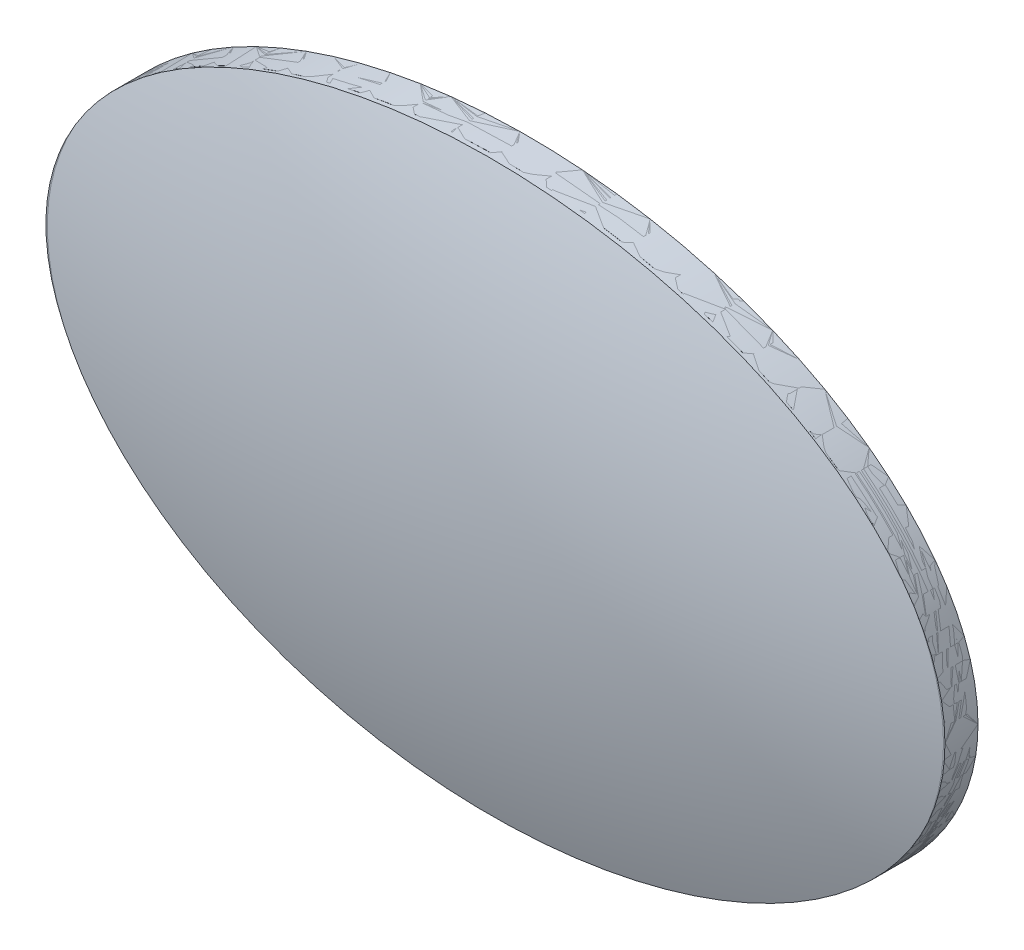
from build123d import *

# Parameters (mm, degrees)
BOSS_EXTRUDE1_DEPTH     = 3.175
SKETCH3_R               = 210.872545424
CUT_EXTRUDE1_DEPTH      = 524.129
CUT_EXTRUDE2_DEPTH      = 524.129
CUT_EXTRUDE2_DEPTH_BACK = 524.129
SKETCH4_R               = 61.79011218
BOSS_EXTRUDE2_REACH     = 53.791
SKETCH6_R               = 4.25
CUT_EXTRUDE3_DEPTH      = 3.5


# Read off the part's stored shape, not the designer's step: Boss-Extrude1
with BuildPart() as part:
    # Boss-Extrude1 outline → Boss-Extrude1 (new body)
    with BuildSketch(Plane.XY):
        with BuildLine():
            add(Edge.make_bspline(
                [(43.18, 0), (43.18, 3.487869372), (41.04308468, 10.463608115), (31.572396318, 19.629385836), (17.132135744, 25.842526194), (0, 28.036236903), (-17.132135744, 25.842526194), (-31.572396318, 19.629385836), (-41.04308468, 10.463608115), (-44.24845766, 0), (-41.04308468, -10.463608115), (-31.572396318, -19.629385836), (-17.132135744, -25.842526194), (0, -28.036236903), (17.132135744, -25.842526194), (31.572396318, -19.629385836), (41.04308468, -10.463608115), (43.18, -3.487869372), (43.18, 0)],
                knots=[0, 0, 0, 0, 0.392699082, 0.785398163, 1.178097245, 1.570796327, 1.963495408, 2.35619449, 2.748893572, 3.141592654, 3.534291735, 3.926990817, 4.319689899, 4.71238898, 5.105088062, 5.497787144, 5.890486225, 6.283185307, 6.283185307, 6.283185307, 6.283185307], degree=3))
        make_face()
    extrude(amount=BOSS_EXTRUDE1_DEPTH)


with BuildPart() as body_2:
    # Sketch2 → Revolve1 (revolve)
    with BuildSketch(Plane.XY.offset(-168.171923244)):
        with BuildLine():
            Line((0, 104.775), (0, 111.125))
            add(Edge.make_bspline(
                [(0, 111.125), (-25.6850603, 111.125), (-68.985756192, 107.923102763), (-144.491866473, 82.828551423), (-194.510279111, 0), (-144.662239102, -82.828551423), (-68.463431094, -107.923102763), (-26.812062356, -111.125), (0, -111.125)],
                knots=[0, 0, 0, 0, 0.152479171, 0.306817145, 0.5, 0.693182855, 0.847520829, 1, 1, 1, 1], degree=3))
            Line((0, -111.125), (0, -104.775))
            add(Edge.make_bspline(
                [(0, -104.775), (-0.171719551, -104.775), (-0.339960895, -104.774935341), (-3.053437978, -104.772860622), (-8.190766555, -104.738608012), (-13.107715438, -104.636837025), (-20.568808866, -104.421053121), (-25.339746217, -104.199600548), (-39.238452343, -103.268644468), (-47.950847553, -102.293557604), (-58.827303545, -100.510941168), (-61.00197668, -100.126156808), (-65.367166047, -99.296750098), (-67.559783414, -98.851910173), (-74.171137403, -97.424254002), (-78.611523138, -96.347877617), (-91.895410377, -92.6549551), (-100.700061603, -89.573590942), (-113.299275818, -83.681916807), (-117.398007221, -81.506750773), (-123.333519574, -77.885436226), (-125.276645483, -76.618564852), (-129.082652994, -73.958072983), (-130.943992005, -72.564959693), (-140.052843424, -65.252894529), (-146.694022396, -58.318049468), (-157.867866053, -43.071658706), (-162.398838205, -34.762308754), (-167.071540269, -21.890519252), (-168.276136939, -17.532153192), (-169.902554344, -8.777109056), (-170.324615699, -4.380780105), (-170.315618169, 4.367718599), (-169.884501784, 8.76460805), (-168.240967164, 17.521562319), (-167.028311047, 21.881267793), (-162.335053285, 34.75759435), (-157.795184186, 43.0706108), (-146.626276987, 58.323260071), (-139.998893431, 65.260747179), (-130.930547188, 72.57433306), (-129.078580269, 73.967653828), (-125.293874883, 76.627906362), (-123.362505498, 77.894418251), (-117.463453676, 81.514258744), (-113.390619307, 83.687941868), (-100.856345038, 89.57533659), (-92.077733287, 92.654250235), (-78.738710637, 96.345156511), (-74.264296231, 97.421083231), (-67.570351392, 98.848272549), (-65.344328139, 99.293032902), (-60.903607466, 100.122635351), (-58.687172846, 100.507643111), (-47.596026304, 102.291635707), (-38.693445228, 103.268203901), (-20.105885244, 104.510223459), (-10.420601756, 104.775), (0, 104.775)],
                knots=[0, 0, 0, 0, 0.000976562, 0.000976562, 0.015625, 0.03125, 0.03125, 0.0625, 0.0625, 0.125, 0.125, 0.140625, 0.140625, 0.15625, 0.15625, 0.1875, 0.1875, 0.25, 0.25, 0.28125, 0.28125, 0.296875, 0.296875, 0.3125, 0.3125, 0.375, 0.375, 0.4375, 0.4375, 0.46875, 0.46875, 0.5, 0.5, 0.53125, 0.53125, 0.5625, 0.5625, 0.625, 0.625, 0.6875, 0.6875, 0.703125, 0.703125, 0.71875, 0.71875, 0.75, 0.75, 0.8125, 0.8125, 0.84375, 0.84375, 0.859375, 0.859375, 0.875, 0.875, 0.9375, 0.9375, 1, 1, 1, 1], degree=3))
        make_face()
    revolve(axis=Axis((0, 104.775, -168.171923244), (0, 1, 0)))

    # Sketch3 → Cut-Extrude1 (cut)
    with BuildSketch(Plane.XY):
        Circle(SKETCH3_R)
    extrude(amount=-CUT_EXTRUDE1_DEPTH, mode=Mode.SUBTRACT)

    # Sketch4 → Cut-Extrude2 (cut, two sides: drawn at the far end of the back side and taken through both)
    with BuildSketch(Plane.XY.offset(-CUT_EXTRUDE2_DEPTH_BACK)):
        Circle(SKETCH4_R)
        with BuildLine():
            add(Edge.make_bspline(
                [(43.18, 0), (43.18, 3.487869372), (41.04308468, 10.463608115), (31.572396318, 19.629385836), (17.132135744, 25.842526194), (0, 28.036236903), (-17.132135744, 25.842526194), (-31.572396318, 19.629385836), (-41.04308468, 10.463608115), (-44.24845766, 0), (-41.04308468, -10.463608115), (-31.572396318, -19.629385836), (-17.132135744, -25.842526194), (0, -28.036236903), (17.132135744, -25.842526194), (31.572396318, -19.629385836), (41.04308468, -10.463608115), (43.18, -3.487869372), (43.18, 0)],
                knots=[0, 0, 0, 0, 0.392699082, 0.785398163, 1.178097245, 1.570796327, 1.963495408, 2.35619449, 2.748893572, 3.141592654, 3.534291735, 3.926990817, 4.319689899, 4.71238898, 5.105088062, 5.497787144, 5.890486225, 6.283185307, 6.283185307, 6.283185307, 6.283185307], degree=3))
        make_face(mode=Mode.SUBTRACT)
    extrude(amount=CUT_EXTRUDE2_DEPTH + CUT_EXTRUDE2_DEPTH_BACK, mode=Mode.SUBTRACT)

    # Sketch5 → Boss-Extrude2 (add, up to next)
    with BuildSketch(Plane(origin=(0, 0, 0), x_dir=(-1, 0, 0), z_dir=(0, 0, -1)), mode=Mode.PRIVATE) as boss_extrude2_sk1:
        Polygon((0, 23.110638672), (-33.338053903, 9.22412145), (-31.871168281, -8.671883139), (-9.378922077, -22.265023236), (16.304185416, -20.159850491), (26.315294725, -12.583578131), (31.536274547, 5.533568798), (19.176451365, 17.732058057), align=None)
    boss_extrude2_tool1 = extrude(boss_extrude2_sk1.sketch, amount=-BOSS_EXTRUDE2_REACH, mode=Mode.PRIVATE) - body_2.part
    add(boss_extrude2_tool1.solids().sort_by_distance((0.704013, -0.268334, 0))[0])

    # Sketch6 → Cut-Extrude3 (cut)
    with BuildSketch(Plane(origin=(0, 0, 0), x_dir=(-1, 0, 0), z_dir=(0, 0, -1))):
        with Locations(Location((-10.255774877, -12.532527364, 0), (0, 0, 180))):
            Circle(SKETCH6_R)
        with Locations((10.255774877, 12.532527364)):
            Circle(SKETCH6_R)
        with Locations((10.255774877, -12.532527364)):
            Circle(SKETCH6_R)
        with Locations(Location((-10.255774877, 12.532527364, 0), (0, 0, 180))):
            Circle(SKETCH6_R)
    extrude(amount=-CUT_EXTRUDE3_DEPTH, mode=Mode.SUBTRACT)


solid = Compound([part.part, body_2.part])
